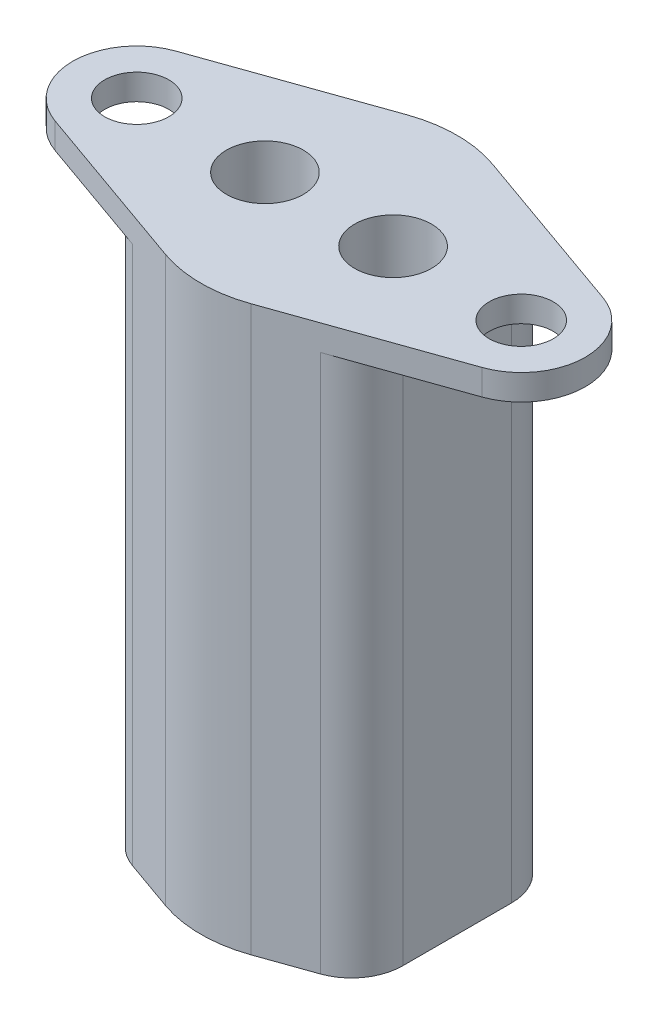
from build123d import *

# Parameters (mm, degrees)
SKETCH2_R               = 1.25
BOSS_EXTRUDE1_DEPTH     = 2
CUT_EXTRUDE1_DEPTH      = 12.357816692
CUT_EXTRUDE1_DEPTH_BACK = 12.357816692
SKETCH3_W               = 5
SKETCH3_H               = 1
FILLET1_R               = 2
BOSS_EXTRUDE2_START     = 20
BOSS_EXTRUDE2_DEPTH     = 20
SKETCH6_R               = 1.5
CUT_EXTRUDE2_DEPTH      = 25.677925359


with BuildPart() as part:
    # Sketch2 → Boss-Extrude1 (new body)
    with BuildSketch(Plane(origin=(0, 0, 0), x_dir=(1, 0, 0), z_dir=(0, 1, 0))):
        with BuildLine():
            Line((-8.333333333, -2.357022604), (-1.666666667, -4.714045208))
            ThreePointArc((-1.666666667, -4.714045208), (0, -5), (1.666666667, -4.714045208))
            Line((1.666666667, -4.714045208), (8.333333333, -2.357022604))
            ThreePointArc((8.333333333, -2.357022604), (10, 0), (8.333333333, 2.357022604))
            Line((8.333333333, 2.357022604), (1.666666667, 4.714045208))
            ThreePointArc((1.666666667, 4.714045208), (0, 5), (-1.666666667, 4.714045208))
            Line((-1.666666667, 4.714045208), (-8.333333333, 2.357022604))
            ThreePointArc((-8.333333333, 2.357022604), (-10, 0), (-8.333333333, -2.357022604))
        make_face()
        with Locations((-7.5, 0)):
            Circle(SKETCH2_R, mode=Mode.SUBTRACT)
        with Locations((7.5, 0)):
            Circle(SKETCH2_R, mode=Mode.SUBTRACT)
    extrude(amount=BOSS_EXTRUDE1_DEPTH)

    # Sketch3 → Cut-Extrude1 (cut, two sides: drawn at the far end of the back side and taken through both)
    with BuildSketch(Plane.XY.offset(-CUT_EXTRUDE1_DEPTH_BACK)):
        with Locations((-7.5, 0.5)):
            Rectangle(SKETCH3_W, SKETCH3_H)
        with Locations((7.5, 0.5)):
            Rectangle(SKETCH3_W, SKETCH3_H)
    extrude(amount=CUT_EXTRUDE1_DEPTH + CUT_EXTRUDE1_DEPTH_BACK, mode=Mode.SUBTRACT)

    # Fillet1
    fillet1_edges = [part.edges().sort_by_distance(p)[0] for p in [
        (5, 0.5, 3.535533906),
        (5, 0.5, -3.535533906),
        (-5, 0.5, -3.535533906),
        (-5, 0.5, 3.535533906),
    ]]
    fillet(fillet1_edges, radius=FILLET1_R)

    # Sketch5 → Boss-Extrude2 (add)
    with BuildSketch(Plane.XZ.offset(BOSS_EXTRUDE2_START)):
        with BuildLine():
            Line((5, -2.121320344), (5, 2.121320344))
            ThreePointArc((5, 2.121320344), (4.632993162, 3.276020882), (3.666666667, 4.006938427))
            Line((3.666666667, 4.006938427), (1.666666667, 4.714045208))
            ThreePointArc((1.666666667, 4.714045208), (0, 5), (-1.666666667, 4.714045208))
            Line((-1.666666667, 4.714045208), (-3.666666667, 4.006938427))
            ThreePointArc((-3.666666667, 4.006938427), (-4.632993162, 3.276020882), (-5, 2.121320344))
            Line((-5, 2.121320344), (-5, -2.121320344))
            ThreePointArc((-5, -2.121320344), (-4.632993162, -3.276020882), (-3.666666667, -4.006938427))
            Line((-3.666666667, -4.006938427), (-1.666666667, -4.714045208))
            ThreePointArc((-1.666666667, -4.714045208), (0, -5), (1.666666667, -4.714045208))
            Line((1.666666667, -4.714045208), (3.666666667, -4.006938427))
            ThreePointArc((3.666666667, -4.006938427), (4.632993162, -3.276020882), (5, -2.121320344))
        make_face()
    extrude(amount=-BOSS_EXTRUDE2_DEPTH)

    # Sketch6 → Cut-Extrude2 (cut, through all)
    with BuildSketch(Plane.XZ.offset(20)):
        with Locations((-2.5, 0)):
            Circle(SKETCH6_R)
        with Locations((2.5, 0)):
            Circle(SKETCH6_R)
    extrude(amount=-CUT_EXTRUDE2_DEPTH, mode=Mode.SUBTRACT)


solid = part.part
